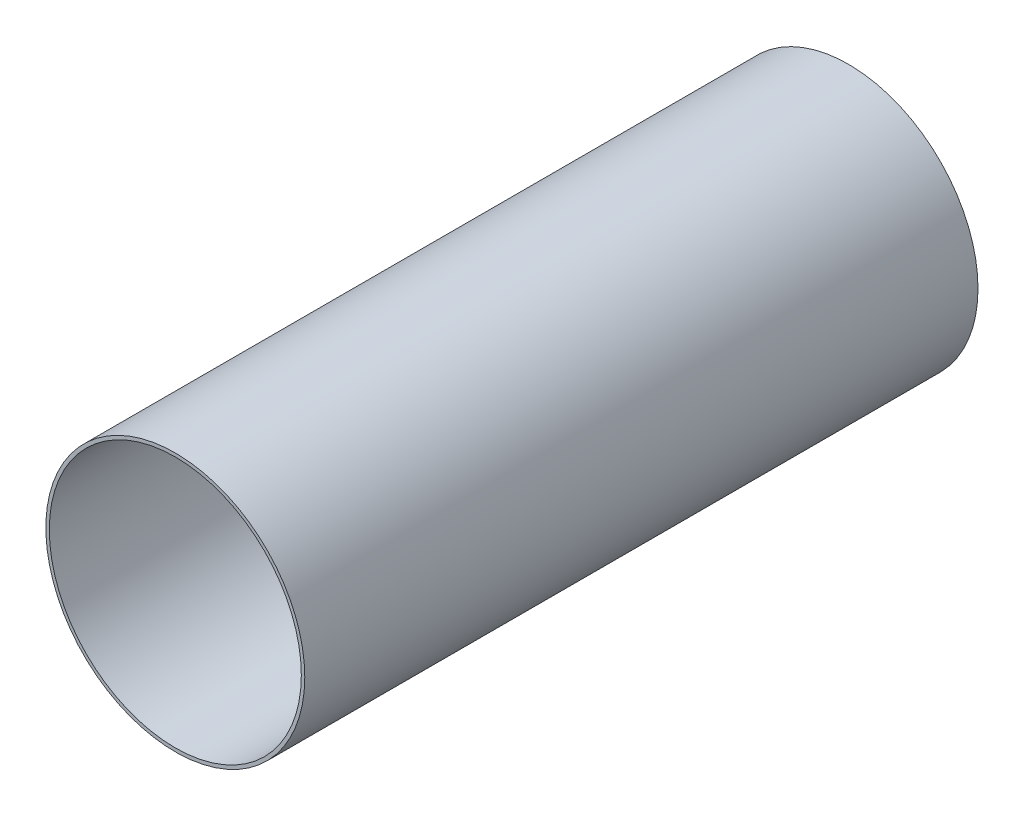
from build123d import *

# Parameters (mm, degrees)
SCHIZZO1_R                = 75
SCHIZZO1_R_2              = 73
ESTRUSIONE_SOTTILE1_DEPTH = 390


with BuildPart() as part:
    # Schizzo1 → Estrusione-Sottile1 (new body)
    with BuildSketch(Plane.XY):
        Circle(SCHIZZO1_R)
        Circle(SCHIZZO1_R_2, mode=Mode.SUBTRACT)
    extrude(amount=ESTRUSIONE_SOTTILE1_DEPTH)


solid = part.part
